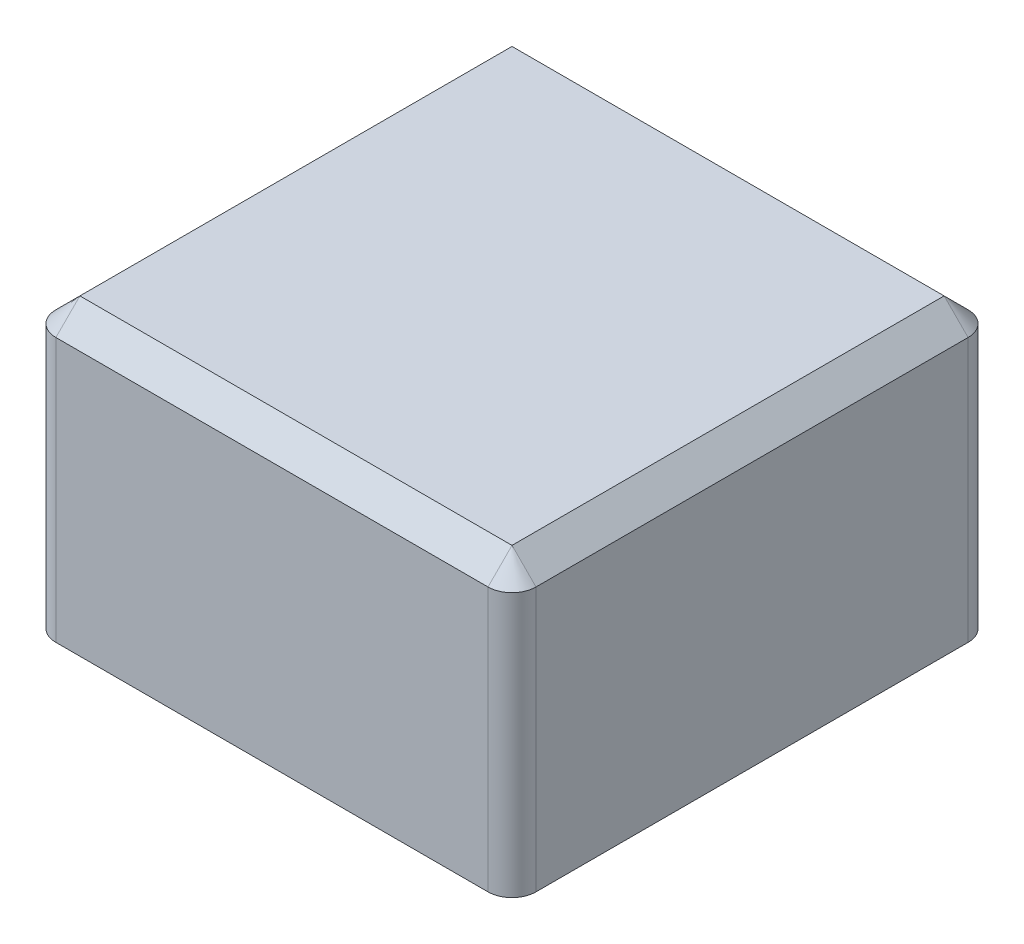
from build123d import *

# Parameters (mm, degrees)
DODANIE_WYCI_GNI_CIE1_DEPTH = 100
ZAOKR_GLENIE3_R             = 5
SFAZOWANIE1_SIZE            = 5


with BuildPart() as part:
    # Szkic 3D1 → Dodanie-wyciągnięcie1 (new body)
    with BuildSketch(Plane(origin=(0, 0, 0), x_dir=(0.8574929257125442, 0.5144957554275265, 0), z_dir=(0, 0, 1))):
        Polygon((0, 0), (85.749292571, -51.449575543), (116.619037897, 0), (30.869745326, 51.449575543), align=None)
    extrude(amount=DODANIE_WYCI_GNI_CIE1_DEPTH)

    # Zaokrąglenie3
    zaokr_glenie3_edges = [part.edges().sort_by_distance(p)[0] for p in [
        (0, 30, 100),
        (0, 30, 0),
        (100, 30, 0),
        (100, 30, 100),
    ]]
    fillet(zaokr_glenie3_edges, radius=ZAOKR_GLENIE3_R)

    # Sfazowanie1
    sfazowanie1_edges = [part.edges().sort_by_distance(p)[0] for p in [
        (50, 60, 100),
        (0, 60, 50),
        (100, 60, 50),
        (50, 60, 0),
        (98.535533906, 60, 98.535533906),
        (98.535533906, 60, 1.464466094),
        (1.464466094, 60, 1.464466094),
        (1.464466094, 60, 98.535533906),
    ]]
    chamfer(sfazowanie1_edges, length=SFAZOWANIE1_SIZE - 0.0001)  # a hair under: the kernel refuses the full size


solid = part.part
